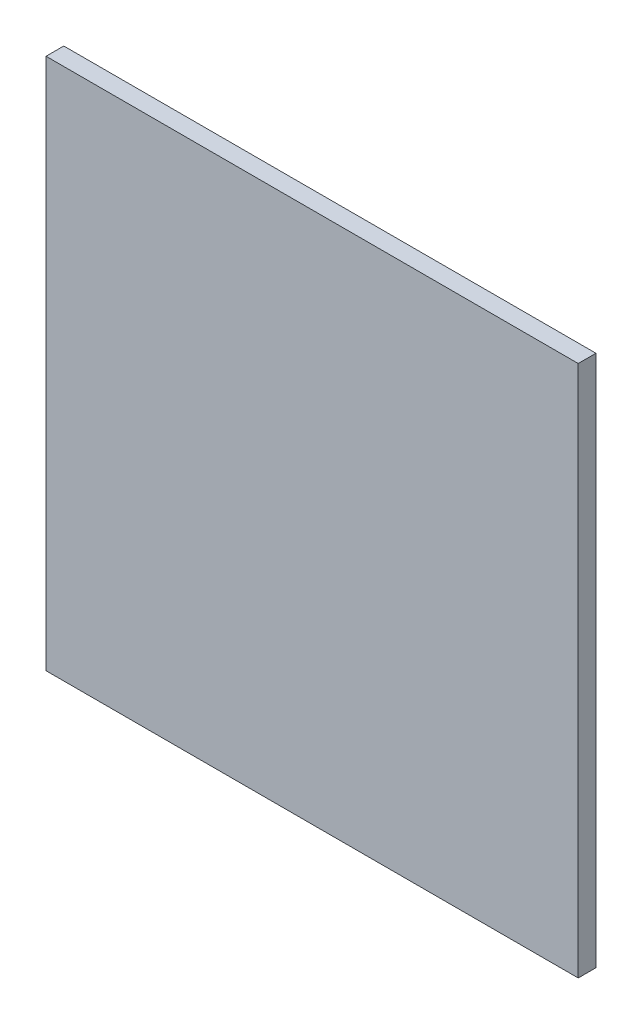
from build123d import *

# Parameters (mm, degrees)
SKETCH1_W           = 1800
SKETCH1_H           = 1800
BOSS_EXTRUDE1_DEPTH = 60


with BuildPart() as part:
    # Sketch1 → Boss-Extrude1 (new body)
    with BuildSketch(Plane.XY):
        Rectangle(SKETCH1_W, SKETCH1_H)
    extrude(amount=BOSS_EXTRUDE1_DEPTH)


solid = part.part
